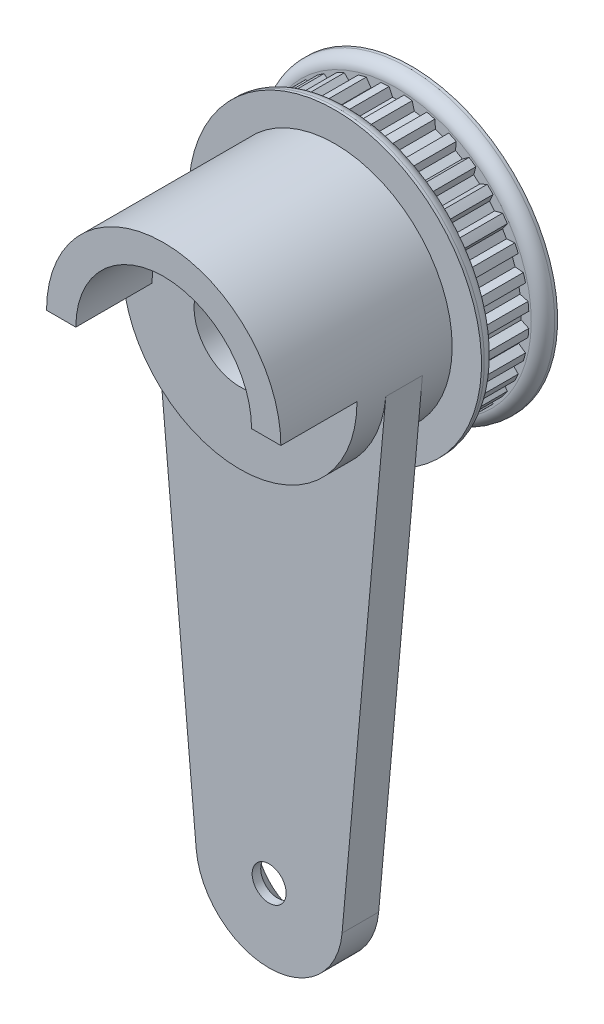
from build123d import *

# Parameters (mm, degrees)
SKETCH1_R                                         = 13.97
BOSS_EXTRUDE1_DEPTH                               = 12.7
SKETCH2_W                                         = 11.176
SKETCH2_H                                         = 10.668
FILLET2_R                                         = 0.2794
CUT_EXTRUDE1_DEPTH                                = 31.990081987
FILLET1_R                                         = 0.5984748
CIRPATTERN1_COUNT                                 = 20
FILLET1_OF_CIRPATTERN1_R                          = 0.5984748
SKETCH5_R                                         = 6.35
CUT_EXTRUDE2_DEPTH                                = 31.978829136
CHAMFER1_SIZE                                     = 0.5334
SKETCH7_R                                         = 15.875
CUT_EXTRUDE6_DEPTH                                = 2.54
SKETCH6_R                                         = 15.875
CUT_EXTRUDE7_DEPTH                                = 16.5735
SKETCH9_R                                         = 6.35
SKETCH9_R_2                                       = 3.96875
BOSS_EXTRUDE3_DEPTH                               = 4.7625
BOSS_EXTRUDE2_START                               = 3.175
SKETCH8_R                                         = 3.96875
BOSS_EXTRUDE2_DEPTH                               = 3.175
BOSS_EXTRUDE4_START                               = 2.54
SKETCH10_R                                        = 10.16
SKETCH10_R_2                                      = 3.96875
BOSS_EXTRUDE4_DEPTH                               = 2.54
BOSS_EXTRUDE5_START                               = 6.604
BOSS_EXTRUDE5_DEPTH                               = 6.604
SKETCH13_R                                        = 15.875
CUT_EXTRUDE8_DEPTH                                = 4.7625
SKETCH18_R                                        = 10.16
SKETCH18_R_2                                      = 3.96875
BOSS_EXTRUDE10_DEPTH                              = 2.54
SKETCH16_R                                        = 12.7
SKETCH16_R_2                                      = 3.96875
BOSS_EXTRUDE8_DEPTH                               = 1.27
SKETCH14_R                                        = 3.96875
BOSS_EXTRUDE6_DEPTH                               = 4.064
SKETCH15_R                                        = 12.7
SKETCH15_R_2                                      = 3.96875
BOSS_EXTRUDE7_DEPTH                               = 1.27
FILLET3_R                                         = 1.016
CSK_FOR_4_FLAT_HEAD_MACHINE_SCREW_100_D           = 2.9464
CSK_FOR_4_FLAT_HEAD_MACHINE_SCREW_100_CSINK_D     = 8.742045
CSK_FOR_4_FLAT_HEAD_MACHINE_SCREW_100_CSINK_ANGLE = 100


with BuildPart() as part:
    # Sketch1 → Boss-Extrude1 (new body)
    with BuildSketch(Plane.XY):
        Circle(SKETCH1_R)
    extrude(amount=-BOSS_EXTRUDE1_DEPTH)

    # Sketch2 → Revolve1 (revolve)
    with BuildSketch(Plane(origin=(0, 0, 0), x_dir=(0, 0, -1), z_dir=(1, 0, 0)), mode=Mode.PRIVATE) as revolve1_sk:
        with Locations((18.288, 5.334)):
            Rectangle(SKETCH2_W, SKETCH2_H)
    revolve(revolve1_sk.sketch.rotate(Axis((0, 0, -12.7), (0, 0, -1)), 90), axis=Axis((0, 0, -12.7), (0, 0, -1)))

    # Fillet2
    fillet2_edges = [part.edges().sort_by_distance(p)[0] for p in [
        (-13.97, 0, 0),
        (-13.97, 0, -12.7),
        (-10.668, 0, -12.7),
    ]]
    fillet(fillet2_edges, radius=FILLET2_R)

    # Sketch4 → Cut-Extrude1 (cut, through all)
    with BuildSketch(Plane.XY):
        with BuildLine():
            Line((0.210823499, 11.932233972), (0.210823499, 11.228631013))
            ThreePointArc((0.210823499, 11.228631013), (0.881145561, 11.195989616), (1.54832106, 11.123367425))
            Line((1.54832106, 11.123367425), (1.658389068, 11.818307824))
            add(Edge.make_bspline(
                [(5.904499611, 15.819097373), (2.715567633, 14.578951978), (1.658389068, 11.818307824)],
                knots=[0, 0, 0, 1, 1, 1], degree=2))
            ThreePointArc((5.904499611, 15.819097373), (1.324793594, 16.833059119), (-3.35714731, 16.548006506))
            add(Edge.make_bspline(
                [(-3.35714731, 16.548006506), (-0.40147849, 14.824269404), (0.210823499, 11.932233972)],
                knots=[0, 0, 0, 1, 1, 1], degree=2))
        make_face()
    cut_extrude1 = extrude(amount=-CUT_EXTRUDE1_DEPTH, mode=Mode.SUBTRACT)

    # Fillet1
    fillet1_edges = [part.edges().sort_by_distance(p)[0] for p in [
        (1.54832106, 11.123367425, -6.35),
        (0.210823499, 11.228631013, -6.35),
    ]]
    fillet(fillet1_edges, radius=FILLET1_R)

    # CirPattern1: Cut-Extrude1 ×20 about axis
    cirpattern1_axis = Axis((0, 0, -12.7), (0, 0, 1))
    for i in range(1, CIRPATTERN1_COUNT):
        add(cut_extrude1.rotate(cirpattern1_axis, i * 360 / CIRPATTERN1_COUNT), mode=Mode.SUBTRACT)

    # Fillet1 of CirPattern1
    fillet1_of_cirpattern1_edges = [part.edges().sort_by_distance(p)[0] for p in [
        (-1.964768736, 11.057408593, -6.35),
        (-3.269332744, 10.744210738, -6.35),
        (-5.285533278, 9.909073566, -6.35),
        (-6.429463919, 9.208072256, -6.35),
        (-8.088912997, 7.790769378, -6.35),
        (-8.96023437, 6.770583506, -6.35),
        (-10.100493552, 4.909850402, -6.35),
        (-10.61391465, 3.670342869, -6.35),
        (-11.123367425, 1.54832106, -6.35),
        (-11.228631013, 0.210823499, -6.35),
        (-11.057408593, -1.964768736, -6.35),
        (-10.744210738, -3.269332744, -6.35),
        (-9.909073566, -5.285533278, -6.35),
        (-9.208072256, -6.429463919, -6.35),
        (-7.790769378, -8.088912997, -6.35),
        (-6.770583506, -8.96023437, -6.35),
        (-4.909850402, -10.100493552, -6.35),
        (-3.670342869, -10.61391465, -6.35),
        (-1.54832106, -11.123367425, -6.35),
        (-0.210823499, -11.228631013, -6.35),
        (1.964768736, -11.057408593, -6.35),
        (3.269332744, -10.744210738, -6.35),
        (5.285533278, -9.909073566, -6.35),
        (6.429463919, -9.208072256, -6.35),
        (8.088912997, -7.790769378, -6.35),
        (8.96023437, -6.770583506, -6.35),
        (10.100493552, -4.909850402, -6.35),
        (10.61391465, -3.670342869, -6.35),
        (11.123367425, -1.54832106, -6.35),
        (11.228631013, -0.210823499, -6.35),
        (11.057408593, 1.964768736, -6.35),
        (10.744210738, 3.269332744, -6.35),
        (9.909073566, 5.285533278, -6.35),
        (9.208072256, 6.429463919, -6.35),
        (7.790769378, 8.088912997, -6.35),
        (6.770583506, 8.96023437, -6.35),
        (4.909850402, 10.100493552, -6.35),
        (3.670342869, 10.61391465, -6.35),
    ]]
    fillet(fillet1_of_cirpattern1_edges, radius=FILLET1_OF_CIRPATTERN1_R)

    # Sketch5 → Cut-Extrude2 (cut, through all)
    with BuildSketch(Plane.XY):
        Circle(SKETCH5_R)
    extrude(amount=-CUT_EXTRUDE2_DEPTH, mode=Mode.SUBTRACT)

    # Chamfer1
    chamfer1_edges = [part.edges().sort_by_distance(p)[0] for p in [
        (-10.668, 0, -23.876),
        (-6.35, 0, -23.876),
        (-6.35, 0, 0),
    ]]
    chamfer(chamfer1_edges, length=CHAMFER1_SIZE)

    # Sketch7 → Cut-Extrude6 (cut)
    with BuildSketch(Plane.XY):
        Circle(SKETCH7_R)
    extrude(amount=-CUT_EXTRUDE6_DEPTH, mode=Mode.SUBTRACT)

    # Sketch6 → Cut-Extrude7 (cut)
    with BuildSketch(Plane(origin=(0, 0, -23.876), x_dir=(-1, 0, 0), z_dir=(0, 0, -1))):
        Circle(SKETCH6_R)
    extrude(amount=-CUT_EXTRUDE7_DEPTH, mode=Mode.SUBTRACT)

    # Sketch9 → Boss-Extrude3 (add)
    with BuildSketch(Plane.XY.offset(-2.54)):
        Circle(SKETCH9_R)
        Circle(SKETCH9_R_2, mode=Mode.SUBTRACT)
    extrude(amount=-BOSS_EXTRUDE3_DEPTH)

    # Sketch8 → Boss-Extrude2 (add)
    with BuildSketch(Plane.XY.offset(-2.54).offset(BOSS_EXTRUDE2_START)):
        with BuildLine():
            Line((10.119178406, -0.909850746), (6.324486504, -43.113656716))
            ThreePointArc((6.324486504, -43.113656716), (0, -48.895), (-6.324486504, -43.113656716))
            Line((-6.324486504, -43.113656716), (-10.119178406, -0.909850746))
            ThreePointArc((-10.119178406, -0.909850746), (0, 10.16), (10.119178406, -0.909850746))
        make_face()
        Circle(SKETCH8_R, mode=Mode.SUBTRACT)
    extrude(amount=-BOSS_EXTRUDE2_DEPTH)

    # Sketch10 → Boss-Extrude4 (add)
    with BuildSketch(Plane.XY.offset(0.635).offset(BOSS_EXTRUDE4_START)):
        with Locations(Location((0, 0, 0), (0, 0, 185.137848249))):
            Circle(SKETCH10_R)
        Circle(SKETCH10_R_2, mode=Mode.SUBTRACT)
    extrude(amount=-BOSS_EXTRUDE4_DEPTH)

    # Sketch12 → Boss-Extrude5 (add)
    with BuildSketch(Plane.XY.offset(3.175).offset(BOSS_EXTRUDE5_START)):
        with BuildLine():
            Line((-10.16, 0), (-7.62, 0))
            ThreePointArc((-7.62, 0), (0, 7.62), (7.62, 0))
            Line((7.62, 0), (10.16, 0))
            ThreePointArc((10.16, 0), (0, 10.16), (-10.16, 0))
        make_face()
    extrude(amount=-BOSS_EXTRUDE5_DEPTH)

    # Sketch13 → Cut-Extrude8 (cut)
    with BuildSketch(Plane(origin=(0, 0, -7.3025), x_dir=(-1, 0, 0), z_dir=(0, 0, -1))):
        Circle(SKETCH13_R)
    extrude(amount=-CUT_EXTRUDE8_DEPTH, mode=Mode.SUBTRACT)

    # Sketch18 → Boss-Extrude10 (add)
    with BuildSketch(Plane(origin=(0, 0, -2.54), x_dir=(-1, 0, 0), z_dir=(0, 0, -1))):
        Circle(SKETCH18_R)
        with Locations(Location((0, 0, 0), (0, 0, 180))):
            Circle(SKETCH18_R_2, mode=Mode.SUBTRACT)
    extrude(amount=BOSS_EXTRUDE10_DEPTH)

    # Sketch16 → Boss-Extrude8 (add)
    with BuildSketch(Plane(origin=(0, 0, -5.08), x_dir=(-1, 0, 0), z_dir=(0, 0, -1))):
        Circle(SKETCH16_R)
        with Locations(Location((0, 0, 0), (0, 0, 180))):
            Circle(SKETCH16_R_2, mode=Mode.SUBTRACT)
    extrude(amount=BOSS_EXTRUDE8_DEPTH)

    # Sketch14 → Boss-Extrude6 (add)
    with BuildSketch(Plane(origin=(0, 0, -6.35), x_dir=(-1, 0, 0), z_dir=(0, 0, -1))):
        with BuildLine():
            Line((10.591943248, 2.211740116), (10.709630583, 1.544302071))
            Line((10.709630583, 1.544302071), (11.406652083, 1.357535723))
            ThreePointArc((11.406652083, 1.357535723), (11.44343792, 1.001171087), (11.469093012, 0.643832637))
            Line((11.469093012, 0.643832637), (10.815092471, 0.338867176))
            Line((10.815092471, 0.338867176), (10.815092471, -0.338867176))
            Line((10.815092471, -0.338867176), (11.469093012, -0.643832636))
            ThreePointArc((11.469093012, -0.643832636), (11.44343792, -1.001171091), (11.406652082, -1.357535731))
            Line((11.406652082, -1.357535731), (10.709630582, -1.544302079))
            Line((10.709630582, -1.544302079), (10.591943246, -2.211740123))
            Line((10.591943246, -2.211740123), (11.183051353, -2.625638476))
            ThreePointArc((11.183051353, -2.625638476), (11.095734849, -2.973093194), (10.9976258, -3.317656059))
            Line((10.9976258, -3.317656059), (10.278761988, -3.380548493))
            Line((10.278761988, -3.380548493), (10.046963187, -4.017410463))
            Line((10.046963187, -4.017410463), (10.557218339, -4.527665614))
            ThreePointArc((10.557218339, -4.527665614), (10.41089349, -4.854679363), (10.254442225, -5.176971087))
            Line((10.254442225, -5.176971087), (9.535578412, -5.114078652))
            Line((9.535578412, -5.114078652), (9.196711236, -5.701013818))
            Line((9.196711236, -5.701013818), (9.610609588, -6.292121925))
            ThreePointArc((9.610609588, -6.292121925), (9.409722401, -6.588758556), (9.199682612, -6.878986467))
            Line((9.199682612, -6.878986467), (8.502661112, -6.692220119))
            Line((8.502661112, -6.692220119), (8.067021868, -7.211394754))
            Line((8.067021868, -7.211394754), (8.371987329, -7.865395295))
            ThreePointArc((8.371987329, -7.865395295), (8.122641656, -8.122641658), (7.865395293, -8.37198733))
            Line((7.865395293, -8.37198733), (7.211394752, -8.067021869))
            Line((7.211394752, -8.067021869), (6.692220118, -8.502661113))
            Line((6.692220118, -8.502661113), (6.878986466, -9.199682613))
            ThreePointArc((6.878986466, -9.199682613), (6.588758556, -9.409722401), (6.292121926, -9.610609588))
            Line((6.292121926, -9.610609588), (5.701013819, -9.196711235))
            Line((5.701013819, -9.196711235), (5.114078653, -9.535578411))
            Line((5.114078653, -9.535578411), (5.176971087, -10.254442224))
            ThreePointArc((5.176971087, -10.254442224), (4.854679362, -10.41089349), (4.527665612, -10.55721834))
            Line((4.527665612, -10.55721834), (4.017410461, -10.046963188))
            Line((4.017410461, -10.046963188), (3.380548491, -10.278761988))
            Line((3.380548491, -10.278761988), (3.317656057, -10.997625801))
            ThreePointArc((3.317656057, -10.997625801), (2.97309319, -11.09573485), (2.62563847, -11.183051355))
            Line((2.62563847, -11.183051355), (2.211740117, -10.591943248))
            Line((2.211740117, -10.591943248), (1.544302073, -10.709630583))
            Line((1.544302073, -10.709630583), (1.357535725, -11.406652082))
            ThreePointArc((1.357535725, -11.406652082), (1.001171088, -11.44343792), (0.643832637, -11.469093012))
            Line((0.643832637, -11.469093012), (0.338867176, -10.815092471))
            Line((0.338867176, -10.815092471), (-0.338867176, -10.815092471))
            Line((-0.338867176, -10.815092471), (-0.643832637, -11.469093012))
            ThreePointArc((-0.643832637, -11.469093012), (-1.00117109, -11.44343792), (-1.357535729, -11.406652082))
            Line((-1.357535729, -11.406652082), (-1.544302077, -10.709630582))
            Line((-1.544302077, -10.709630582), (-2.211740121, -10.591943247))
            Line((-2.211740121, -10.591943247), (-2.625638473, -11.183051354))
            ThreePointArc((-2.625638473, -11.183051354), (-2.973093192, -11.095734849), (-3.317656058, -10.997625801))
            Line((-3.317656058, -10.997625801), (-3.380548492, -10.278761988))
            Line((-3.380548492, -10.278761988), (-4.017410461, -10.046963188))
            Line((-4.017410461, -10.046963188), (-4.527665613, -10.557218339))
            ThreePointArc((-4.527665613, -10.557218339), (-4.854679361, -10.410893491), (-5.176971084, -10.254442226))
            Line((-5.176971084, -10.254442226), (-5.11407865, -9.535578413))
            Line((-5.11407865, -9.535578413), (-5.701013816, -9.196711237))
            Line((-5.701013816, -9.196711237), (-6.292121923, -9.61060959))
            ThreePointArc((-6.292121923, -9.61060959), (-6.588758555, -9.409722402), (-6.878986466, -9.199682612))
            Line((-6.878986466, -9.199682612), (-6.692220118, -8.502661113))
            Line((-6.692220118, -8.502661113), (-7.211394753, -8.067021869))
            Line((-7.211394753, -8.067021869), (-7.865395294, -8.37198733))
            ThreePointArc((-7.865395294, -8.37198733), (-8.122641656, -8.122641658), (-8.371987327, -7.865395296))
            Line((-8.371987327, -7.865395296), (-8.067021866, -7.211394755))
            Line((-8.067021866, -7.211394755), (-8.502661111, -6.692220121))
            Line((-8.502661111, -6.692220121), (-9.19968261, -6.878986469))
            ThreePointArc((-9.19968261, -6.878986469), (-9.4097224, -6.588758557), (-9.610609588, -6.292121925))
            Line((-9.610609588, -6.292121925), (-9.196711236, -5.701013818))
            Line((-9.196711236, -5.701013818), (-9.535578412, -5.114078653))
            Line((-9.535578412, -5.114078653), (-10.254442225, -5.176971087))
            ThreePointArc((-10.254442225, -5.176971087), (-10.410893489, -4.854679364), (-10.557218338, -4.527665616))
            Line((-10.557218338, -4.527665616), (-10.046963187, -4.017410464))
            Line((-10.046963187, -4.017410464), (-10.278761987, -3.380548494))
            Line((-10.278761987, -3.380548494), (-10.9976258, -3.31765606))
            ThreePointArc((-10.9976258, -3.31765606), (-11.095734849, -2.973093194), (-11.183051353, -2.625638475))
            Line((-11.183051353, -2.625638475), (-10.591943247, -2.211740123))
            Line((-10.591943247, -2.211740123), (-10.709630582, -1.544302078))
            Line((-10.709630582, -1.544302078), (-11.406652082, -1.35753573))
            ThreePointArc((-11.406652082, -1.35753573), (-11.44343792, -1.00117109), (-11.469093012, -0.643832637))
            Line((-11.469093012, -0.643832637), (-10.815092471, -0.338867176))
            Line((-10.815092471, -0.338867176), (-10.815092471, 0.338867176))
            Line((-10.815092471, 0.338867176), (-11.469093012, 0.643832637))
            ThreePointArc((-11.469093012, 0.643832637), (-11.44343792, 1.001171089), (-11.406652082, 1.357535726))
            Line((-11.406652082, 1.357535726), (-10.709630582, 1.544302074))
            Line((-10.709630582, 1.544302074), (-10.591943248, 2.211740119))
            Line((-10.591943248, 2.211740119), (-11.183051354, 2.625638471))
            ThreePointArc((-11.183051354, 2.625638471), (-11.09573485, 2.97309319), (-10.997625801, 3.317656056))
            Line((-10.997625801, 3.317656056), (-10.278761988, 3.38054849))
            Line((-10.278761988, 3.38054849), (-10.046963188, 4.01741046))
            Line((-10.046963188, 4.01741046), (-10.55721834, 4.527665612))
            ThreePointArc((-10.55721834, 4.527665612), (-10.410893491, 4.85467936), (-10.254442226, 5.176971083))
            Line((-10.254442226, 5.176971083), (-9.535578413, 5.114078649))
            Line((-9.535578413, 5.114078649), (-9.196711238, 5.701013815))
            Line((-9.196711238, 5.701013815), (-9.61060959, 6.292121922))
            ThreePointArc((-9.61060959, 6.292121922), (-9.409722402, 6.588758554), (-9.199682613, 6.878986465))
            Line((-9.199682613, 6.878986465), (-8.502661114, 6.692220117))
            Line((-8.502661114, 6.692220117), (-8.06702187, 7.211394752))
            Line((-8.06702187, 7.211394752), (-8.371987331, 7.865395293))
            ThreePointArc((-8.371987331, 7.865395293), (-8.122641658, 8.122641656), (-7.865395295, 8.371987328))
            Line((-7.865395295, 8.371987328), (-7.211394754, 8.067021868))
            Line((-7.211394754, 8.067021868), (-6.69222012, 8.502661112))
            Line((-6.69222012, 8.502661112), (-6.878986468, 9.199682611))
            ThreePointArc((-6.878986468, 9.199682611), (-6.588758558, 9.4097224), (-6.292121927, 9.610609587))
            Line((-6.292121927, 9.610609587), (-5.70101382, 9.196711234))
            Line((-5.70101382, 9.196711234), (-5.114078655, 9.53557841))
            Line((-5.114078655, 9.53557841), (-5.176971089, 10.254442223))
            ThreePointArc((-5.176971089, 10.254442223), (-4.854679364, 10.410893489), (-4.527665614, 10.557218339))
            Line((-4.527665614, 10.557218339), (-4.017410463, 10.046963187))
            Line((-4.017410463, 10.046963187), (-3.380548493, 10.278761988))
            Line((-3.380548493, 10.278761988), (-3.317656058, 10.997625801))
            ThreePointArc((-3.317656058, 10.997625801), (-2.973093191, 11.095734849), (-2.625638471, 11.183051354))
            Line((-2.625638471, 11.183051354), (-2.211740119, 10.591943248))
            Line((-2.211740119, 10.591943248), (-1.544302074, 10.709630582))
            Line((-1.544302074, 10.709630582), (-1.357535726, 11.406652082))
            ThreePointArc((-1.357535726, 11.406652082), (-1.001171089, 11.44343792), (-0.643832637, 11.469093012))
            Line((-0.643832637, 11.469093012), (-0.338867176, 10.815092471))
            Line((-0.338867176, 10.815092471), (0.338867176, 10.815092471))
            Line((0.338867176, 10.815092471), (0.643832636, 11.469093012))
            ThreePointArc((0.643832636, 11.469093012), (1.001171088, 11.44343792), (1.357535726, 11.406652082))
            Line((1.357535726, 11.406652082), (1.544302074, 10.709630583))
            Line((1.544302074, 10.709630583), (2.211740118, 10.591943248))
            Line((2.211740118, 10.591943248), (2.62563847, 11.183051354))
            ThreePointArc((2.62563847, 11.183051354), (2.973093192, 11.095734849), (3.31765606, 10.9976258))
            Line((3.31765606, 10.9976258), (3.380548494, 10.278761987))
            Line((3.380548494, 10.278761987), (4.017410463, 10.046963187))
            Line((4.017410463, 10.046963187), (4.527665616, 10.557218338))
            ThreePointArc((4.527665616, 10.557218338), (4.854679365, 10.410893489), (5.176971089, 10.254442223))
            Line((5.176971089, 10.254442223), (5.114078655, 9.535578411))
            Line((5.114078655, 9.535578411), (5.701013821, 9.196711234))
            Line((5.701013821, 9.196711234), (6.292121927, 9.610609586))
            ThreePointArc((6.292121927, 9.610609586), (6.588758558, 9.4097224), (6.878986467, 9.199682612))
            Line((6.878986467, 9.199682612), (6.692220119, 8.502661112))
            Line((6.692220119, 8.502661112), (7.211394754, 8.067021868))
            Line((7.211394754, 8.067021868), (7.865395294, 8.371987329))
            ThreePointArc((7.865395294, 8.371987329), (8.122641658, 8.122641656), (8.371987331, 7.865395292))
            Line((8.371987331, 7.865395292), (8.06702187, 7.211394752))
            Line((8.06702187, 7.211394752), (8.502661114, 6.692220117))
            Line((8.502661114, 6.692220117), (9.199682613, 6.878986465))
            ThreePointArc((9.199682613, 6.878986465), (9.409722401, 6.588758555), (9.610609588, 6.292121925))
            Line((9.610609588, 6.292121925), (9.196711236, 5.701013818))
            Line((9.196711236, 5.701013818), (9.535578412, 5.114078652))
            Line((9.535578412, 5.114078652), (10.254442225, 5.176971087))
            ThreePointArc((10.254442225, 5.176971087), (10.41089349, 4.854679362), (10.55721834, 4.527665612))
            Line((10.55721834, 4.527665612), (10.046963188, 4.017410461))
            Line((10.046963188, 4.017410461), (10.278761988, 3.380548491))
            Line((10.278761988, 3.380548491), (10.997625801, 3.317656057))
            ThreePointArc((10.997625801, 3.317656057), (11.09573485, 2.973093189), (11.183051355, 2.625638468))
            Line((11.183051355, 2.625638468), (10.591943248, 2.211740116))
        make_face()
        with Locations(Location((0, 0, 0), (0, 0, 180))):
            Circle(SKETCH14_R, mode=Mode.SUBTRACT)
    extrude(amount=BOSS_EXTRUDE6_DEPTH)

    # Sketch15 → Boss-Extrude7 (add)
    with BuildSketch(Plane(origin=(0, 0, -10.414), x_dir=(-1, 0, 0), z_dir=(0, 0, -1))):
        Circle(SKETCH15_R)
        with Locations(Location((0, 0, 0), (0, 0, 180))):
            Circle(SKETCH15_R_2, mode=Mode.SUBTRACT)
    extrude(amount=BOSS_EXTRUDE7_DEPTH)

    # Fillet3
    fillet3_edges = [part.edges().sort_by_distance(p)[0] for p in [
        (12.7, 0, -6.35),
        (12.7, 0, -10.414),
    ]]
    fillet(fillet3_edges, radius=FILLET3_R)

    # CSK for #4 Flat Head Machine Screw (100)1 (through all)
    with Locations(Plane(origin=(0, 0, -2.54), x_dir=(-1, 0, 0), z_dir=(0, 0, -1))):
        with Locations((0, -42.545)):
            CounterSinkHole(CSK_FOR_4_FLAT_HEAD_MACHINE_SCREW_100_D / 2, CSK_FOR_4_FLAT_HEAD_MACHINE_SCREW_100_CSINK_D / 2, counter_sink_angle=CSK_FOR_4_FLAT_HEAD_MACHINE_SCREW_100_CSINK_ANGLE)


solid = part.part
